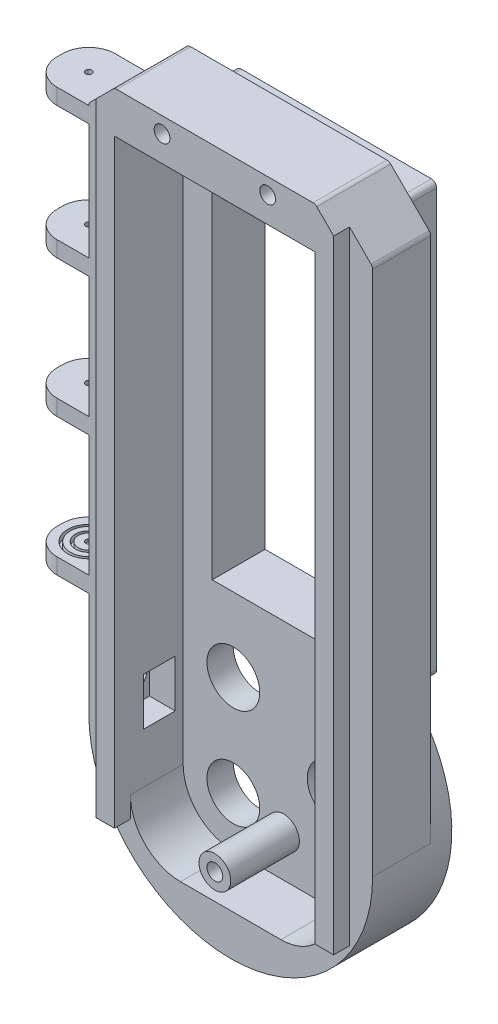
from build123d import *
from build123d.topology import SkipClean

# Parameters (mm, degrees)
CROQUIS1_W               = 27
CROQUIS1_H               = 72
CROQUIS1_R               = 5
SALIENTE_EXTRUIR1_DEPTH  = 5
CROQUIS2_W               = 38
CROQUIS2_H               = 81
CROQUIS2_W_2             = 27
CROQUIS2_H_2             = 72
SALIENTE_EXTRUIR2_DEPTH  = 5
SALIENTE_EXTRUIR9_START  = -1
SALIENTE_EXTRUIR9_DEPTH  = 1
SALIENTE_EXTRUIR10_DEPTH = 11
SALIENTE_EXTRUIR11_DEPTH = 10
REDONDEO1_R              = 1
REDONDEO2_R              = 1
REDONDEO3_R              = 1
CROQUIS6_W               = 6
CROQUIS6_H               = 9
CORTAR_EXTRUIR1_DEPTH    = 8
CROQUIS7_W               = 6
CROQUIS7_H               = 9
CROQUIS7_R               = 2.5
SALIENTE_EXTRUIR12_DEPTH = 3
CROQUIS8_W               = 11
CROQUIS8_H               = 3
SALIENTE_EXTRUIR13_DEPTH = 11
REDONDEO4_R              = 5
CROQUIS9_R               = 0.6
CORTAR_EXTRUIR2_DEPTH    = 80
SALIENTE_EXTRUIR14_START = -2.5
CROQUIS10_R              = 0.6
SALIENTE_EXTRUIR14_DEPTH = 2.5
CROQUIS11_R              = 4
CROQUIS11_R_2            = 3.5
CROQUIS11_R_3            = 2.5
CROQUIS11_R_4            = 2
CORTAR_EXTRUIR3_DEPTH    = 1
SALIENTE_EXTRUIR15_DEPTH = 3
CROQUIS14_R              = 1.5
CORTAR_EXTRUIR4_DEPTH    = 14
CROQUIS16_W              = 3.5
CROQUIS16_H              = 3
SALIENTE_EXTRUIR16_DEPTH = 4
SALIENTE_EXTRUIR21_DEPTH = 18
CROQUIS26_R              = 1.5
CORTAR_EXTRUIR7_DEPTH    = 18


with BuildPart() as part:
    # Croquis1 → Saliente-Extruir1 (new body)
    with BuildSketch(Plane.XY):
        with BuildLine():
            Line((-19, 40.5), (-19, -40.5))
            ThreePointArc((-19, -40.5), (0, -86.370057685), (19, -40.5))
            Line((19, -40.5), (19, 40.5))
            Line((19, 40.5), (-19, 40.5))
        make_face()
        Rectangle(CROQUIS1_W, CROQUIS1_H, mode=Mode.SUBTRACT)
        with Locations((9.5, -59.5)):
            Circle(CROQUIS1_R, mode=Mode.SUBTRACT)
        with Locations((-9.5, -69)):
            Circle(CROQUIS1_R, mode=Mode.SUBTRACT)
        with Locations((-9.5, -50)):
            Circle(CROQUIS1_R, mode=Mode.SUBTRACT)
    extrude(amount=SALIENTE_EXTRUIR1_DEPTH)

    # Croquis2 → Saliente-Extruir2 (add)
    with BuildSketch(Plane(origin=(0, 0, 0), x_dir=(-1, 0, 0), z_dir=(0, 0, -1))):
        Rectangle(CROQUIS2_W, CROQUIS2_H)
        Rectangle(CROQUIS2_W_2, CROQUIS2_H_2, mode=Mode.SUBTRACT)
    extrude(amount=SALIENTE_EXTRUIR2_DEPTH)

    # Croquis3 → Saliente-Extruir9 (add)
    with BuildSketch(Plane.XY.offset(5).offset(SALIENTE_EXTRUIR9_START)):
        with BuildLine():
            Line((26.870057685, -59.5), (26.870057685, 40.5))
            Line((26.870057685, 40.5), (19, 48.370057685))
            Line((19, 48.370057685), (-19, 48.370057685))
            Line((-19, 48.370057685), (-26.870057685, 40.5))
            Line((-26.870057685, 40.5), (-26.870057685, -59.5))
            ThreePointArc((-26.870057685, -59.5), (0, -86.370057685), (26.870057685, -59.5))
        make_face()
        with BuildLine():
            Line((19, -59.5), (19, 40.5))
            Line((19, 40.5), (-19, 40.5))
            Line((-19, 40.5), (-19, -59.5))
            ThreePointArc((-19, -59.5), (0, -78.5), (19, -59.5))
        make_face(mode=Mode.SUBTRACT)
    extrude(amount=SALIENTE_EXTRUIR9_DEPTH)

    # Croquis4 → Saliente-Extruir10 (add)
    with BuildSketch(Plane(origin=(0, 0, 4), x_dir=(-1, 0, 0), z_dir=(0, 0, -1))):
        with BuildLine():
            Line((-19, -40.5), (-19, 40.5))
            Line((-19, 40.5), (19, 40.5))
            Line((19, 40.5), (19, -40.5))
            ThreePointArc((19, -40.5), (24.824696333, -49.217274097), (26.870057685, -59.5))
            Line((26.870057685, -59.5), (26.870057685, 40.5))
            Line((26.870057685, 40.5), (19, 48.370057685))
            Line((19, 48.370057685), (-19, 48.370057685))
            Line((-19, 48.370057685), (-26.870057685, 40.5))
            Line((-26.870057685, 40.5), (-26.870057685, -59.5))
            ThreePointArc((-26.870057685, -59.5), (-24.824696333, -49.217274097), (-19, -40.5))
        make_face()
    extrude(amount=-SALIENTE_EXTRUIR10_DEPTH)

    # Croquis5 → Saliente-Extruir11 (add)
    with SkipClean():  # the faces are left unmerged after this step: merging them gives an invalid solid
        with BuildSketch(Plane.XY.offset(5)):
            with BuildLine():
                Line((-19, -59.5), (-19, -69))
                ThreePointArc((-19, -69), (-16.217514421, -75.717514421), (-9.5, -78.5))
                Line((-9.5, -78.5), (9.5, -78.5))
                ThreePointArc((9.5, -78.5), (16.217514421, -75.717514421), (19, -69))
                Line((19, -69), (19, -59.5))
                Line((19, -59.5), (19, -40.5))
                ThreePointArc((19, -40.5), (0, -86.370057685), (-19, -40.5))
                Line((-19, -40.5), (-19, -59.5))
            make_face()
        extrude(amount=SALIENTE_EXTRUIR11_DEPTH)

    # Redondeo1
    redondeo1_edges = [part.edges().sort_by_distance(p)[0] for p in [
        (-19, -40.5, -2.5),
        (-19, 40.5, -0.5),
        (19, 40.5, -0.5),
        (19, -40.5, -2.5),
    ]]
    fillet(redondeo1_edges, radius=REDONDEO1_R)

    # Redondeo2
    redondeo2_edges = [part.edges().sort_by_distance(p)[0] for p in [
        (-18.707106781, 40.207106781, 4),
        (18.707106781, 40.207106781, 4),
        (-19, -0.5, 4),
        (0, 40.5, 4),
        (19, -0.5, 4),
    ]]
    fillet(redondeo2_edges, radius=REDONDEO2_R)

    # Redondeo3
    redondeo3_edges = [part.edges().sort_by_distance(p)[0] for p in [
        (-26.870057685, 40.5, 9.5),
        (-19, 48.370057685, 9.5),
        (26.870057685, 40.5, 9.5),
        (19, 48.370057685, 9.5),
    ]]
    fillet(redondeo3_edges, radius=REDONDEO3_R)

    # Croquis6 → Cortar-Extruir1 (cut)
    with SkipClean():  # the faces are left unmerged after this step: merging them gives an invalid solid
        with BuildSketch(Plane.ZY.offset(26.870057685)):
            with Locations((9.5, -55)):
                Rectangle(CROQUIS6_W, CROQUIS6_H)
        extrude(amount=-CORTAR_EXTRUIR1_DEPTH, mode=Mode.SUBTRACT)

    # Croquis7 → Saliente-Extruir12 (add)
    with SkipClean():  # the faces are left unmerged after this step: merging them gives an invalid solid
        with BuildSketch(Plane.ZY.offset(26.870057685)):
            with Locations((9.5, -55)):
                Rectangle(CROQUIS7_W, CROQUIS7_H)
            with Locations((9.5, -55)):
                Circle(CROQUIS7_R, mode=Mode.SUBTRACT)
        extrude(amount=-SALIENTE_EXTRUIR12_DEPTH)

    # Croquis8 → Saliente-Extruir13 (add)
    with SkipClean():  # the faces are left unmerged after this step: merging them gives an invalid solid
        with BuildSketch(Plane.ZY.offset(26.870057685)):
            with Locations((9.5, 38.585786438)):
                Rectangle(CROQUIS8_W, CROQUIS8_H)
            with Locations((9.5, 13.585786438)):
                Rectangle(CROQUIS8_W, CROQUIS8_H)
            with Locations((9.5, -12.414213562)):
                Rectangle(CROQUIS8_W, CROQUIS8_H)
            with Locations((9.5, -38.414213562)):
                Rectangle(CROQUIS8_W, CROQUIS8_H)
        extrude(amount=SALIENTE_EXTRUIR13_DEPTH)

    # Redondeo4
    redondeo4_edges = [part.edges().sort_by_distance(p)[0] for p in [
        (-37.870057685, -38.414213562, 4),
        (-37.870057685, -38.414213562, 15),
        (-37.870057685, -12.414213562, 4),
        (-37.870057685, -12.414213562, 15),
        (-37.870057685, 13.585786438, 4),
        (-37.870057685, 13.585786438, 15),
        (-37.870057685, 38.585786438, 4),
        (-37.870057685, 38.585786438, 15),
    ]]
    fillet(redondeo4_edges, radius=REDONDEO4_R)

    # Croquis9 → Cortar-Extruir2 (cut)
    with SkipClean():  # the faces are left unmerged after this step: merging them gives an invalid solid
        with BuildSketch(Plane(origin=(0, 40.085786438, 0), x_dir=(1, 0, 0), z_dir=(0, 1, 0))):
            with Locations((-32.370057685, -9.5)):
                Circle(CROQUIS9_R)
        extrude(amount=-CORTAR_EXTRUIR2_DEPTH, mode=Mode.SUBTRACT)

    # Croquis10 → Saliente-Extruir14 (add)
    with SkipClean():  # the faces are left unmerged after this step: merging them gives an invalid solid
        with BuildSketch(Plane.XZ.offset(39.914213562).offset(SALIENTE_EXTRUIR14_START)):
            with Locations((-32.370057685, 9.5)):
                Circle(CROQUIS10_R)
        extrude(amount=SALIENTE_EXTRUIR14_DEPTH)

    # Croquis11 → Cortar-Extruir3 (cut)
    # profile 1 of 2: a face of its own
    with SkipClean():  # the faces are left unmerged after this step: merging them gives an invalid solid
        with BuildSketch(Plane(origin=(0, -36.914213562, 0), x_dir=(1, 0, 0), z_dir=(0, 1, 0))):
            with Locations((-32.370057685, -9.5)):
                Circle(CROQUIS11_R)
            with Locations((-32.370057685, -9.5)):
                Circle(CROQUIS11_R_2, mode=Mode.SUBTRACT)
        # profile 2 of 2: a face of its own
        with BuildSketch(Plane(origin=(0, -36.914213562, 0), x_dir=(1, 0, 0), z_dir=(0, 1, 0))):
            with Locations((-32.370057685, -9.5)):
                Circle(CROQUIS11_R_3)
            with Locations((-32.370057685, -9.5)):
                Circle(CROQUIS11_R_4, mode=Mode.SUBTRACT)
        extrude(amount=-CORTAR_EXTRUIR3_DEPTH, mode=Mode.SUBTRACT)

    # Croquis13 → Saliente-Extruir15 (add)
    with SkipClean():  # the faces are left unmerged after this step: merging them gives an invalid solid
        with BuildSketch(Plane.XY.offset(15)):
            with BuildLine():
                Line((-19, 40.5), (19, 40.5))
                Line((19, 40.5), (19, -69))
                Line((19, -69), (22.5, -69))
                Line((22.5, -69), (22.5, 44.870057685))
                Line((22.5, 44.870057685), (19.292893219, 48.077164466))
                ThreePointArc((19.292893219, 48.077164466), (18.96846987, 48.293937218), (18.585786438, 48.370057685))
                Line((18.585786438, 48.370057685), (-18.585786438, 48.370057685))
                ThreePointArc((-18.585786438, 48.370057685), (-18.96846987, 48.293937218), (-19.292893219, 48.077164466))
                Line((-19.292893219, 48.077164466), (-22.5, 44.870057685))
                Line((-22.5, 44.870057685), (-22.5, -69))
                Line((-22.5, -69), (-19, -69))
                Line((-19, -69), (-19, 40.5))
            make_face()
        extrude(amount=SALIENTE_EXTRUIR15_DEPTH)

    # Croquis14 → Cortar-Extruir4 (cut)
    with SkipClean():  # the faces are left unmerged after this step: merging them gives an invalid solid
        with BuildSketch(Plane(origin=(0, 0, 4), x_dir=(-1, 0, 0), z_dir=(0, 0, -1))):
            with Locations((10, 45.370057685)):
                Circle(CROQUIS14_R)
            with Locations((-10, 45.370057685)):
                Circle(CROQUIS14_R)
        extrude(amount=-CORTAR_EXTRUIR4_DEPTH, mode=Mode.SUBTRACT)

    # Croquis16 → Saliente-Extruir16 (add)
    with SkipClean():  # the faces are left unmerged after this step: merging them gives an invalid solid
        with BuildSketch(Plane(origin=(0, -69, 0), x_dir=(-1, 0, 0), z_dir=(0, -1, 0))):
            with Locations((20.75, -16.5)):
                Rectangle(CROQUIS16_W, CROQUIS16_H)
            with Locations((-20.75, -16.5)):
                Rectangle(CROQUIS16_W, CROQUIS16_H)
        extrude(amount=SALIENTE_EXTRUIR16_DEPTH)

    # Croquis25 → Saliente-Extruir21 (add)
    with SkipClean():  # the faces are left unmerged after this step: merging them gives an invalid solid
        with BuildSketch(Plane.XY.offset(18)):
            with BuildLine():
                ThreePointArc((3, -70.629942315), (2.121320344, -68.508621971), (0, -67.629942315))
                ThreePointArc((0, -67.629942315), (-2.121320344, -72.751262658), (3, -70.629942315))
            make_face()
            with BuildLine():
                ThreePointArc((1.5, -70.629942315), (-1.060660172, -71.690602487), (0, -69.129942315))
                ThreePointArc((0, -69.129942315), (1.060660172, -69.569282143), (1.5, -70.629942315))
            make_face(mode=Mode.SUBTRACT)
        extrude(amount=-SALIENTE_EXTRUIR21_DEPTH)

    # Croquis26 → Cortar-Extruir7 (cut)
    with SkipClean():  # the faces are left unmerged after this step: merging them gives an invalid solid
        with BuildSketch(Plane.XY.offset(18)):
            with Locations((0, -70.629942315)):
                Circle(CROQUIS26_R)
        extrude(amount=-CORTAR_EXTRUIR7_DEPTH, mode=Mode.SUBTRACT)


solid = part.part
